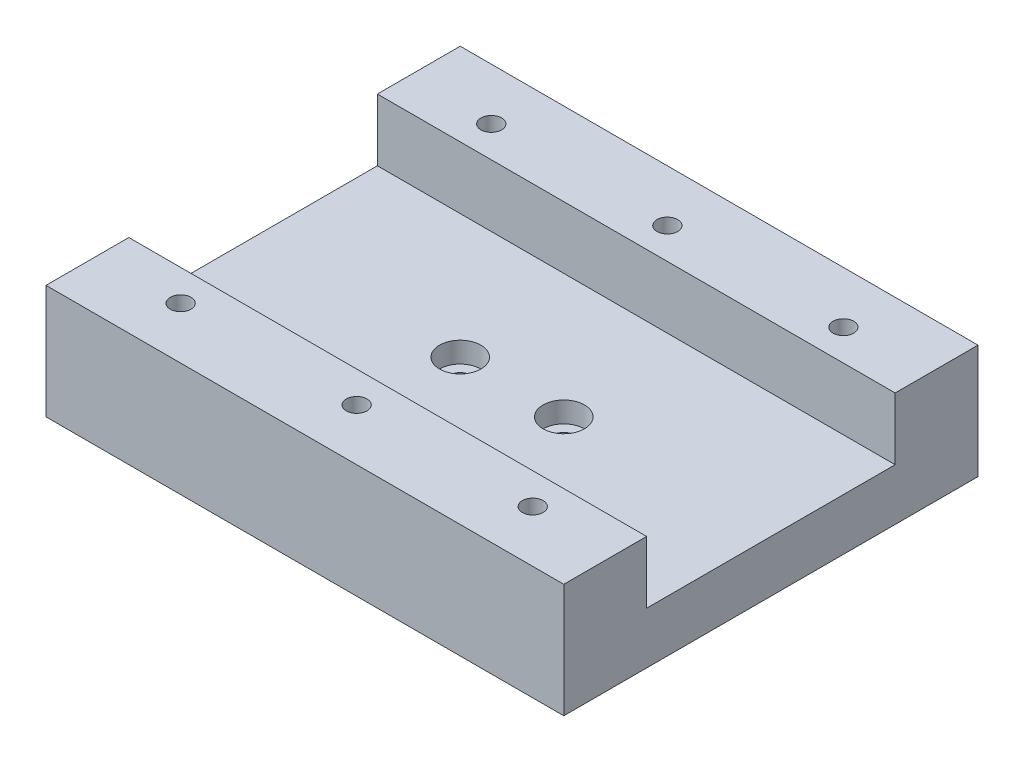
from build123d import *

# Parameters (mm, degrees)
SKETCH1_W               = 50
SKETCH1_H               = 40
BOSS_EXTRUDE1_DEPTH     = 5
SKETCH2_R               = 1
CUT_EXTRUDE1_DEPTH      = 33.403703492
SKETCH3_R               = 2
CUT_EXTRUDE2_DEPTH      = 2
SKETCH5_W               = 50
SKETCH5_H               = 8
BOSS_EXTRUDE2_DEPTH     = 6
CUT_EXTRUDE3_DEPTH      = 33.57299495
CUT_EXTRUDE3_DEPTH_BACK = 33.57299495
SKETCH4_R               = 1


with BuildPart() as part:
    # Sketch1 → Boss-Extrude1 (new body)
    with BuildSketch(Plane(origin=(0, 0, 0), x_dir=(1, 0, 0), z_dir=(0, 1, 0))):
        Rectangle(SKETCH1_W, SKETCH1_H)
    extrude(amount=BOSS_EXTRUDE1_DEPTH)

    # Sketch2 → Cut-Extrude1 (cut, through all)
    with BuildSketch(Plane(origin=(0, 5, 0), x_dir=(1, 0, 0), z_dir=(0, 1, 0))):
        with Locations((-5, 0)):
            Circle(SKETCH2_R)
        with Locations((5, 0)):
            Circle(SKETCH2_R)
    extrude(amount=-CUT_EXTRUDE1_DEPTH, mode=Mode.SUBTRACT)

    # Sketch3 → Cut-Extrude2 (cut)
    with BuildSketch(Plane(origin=(0, 5, 0), x_dir=(1, 0, 0), z_dir=(0, 1, 0))):
        with Locations((-5, 0)):
            Circle(SKETCH3_R)
        with Locations((5, 0)):
            Circle(SKETCH3_R)
    extrude(amount=-CUT_EXTRUDE2_DEPTH, mode=Mode.SUBTRACT)

    # Sketch5 → Boss-Extrude2 (add)
    with BuildSketch(Plane(origin=(0, 5, 0), x_dir=(1, 0, 0), z_dir=(0, 1, 0))):
        with Locations((0, 16)):
            Rectangle(SKETCH5_W, SKETCH5_H)
        with Locations((0, -16)):
            Rectangle(SKETCH5_W, SKETCH5_H)
    extrude(amount=BOSS_EXTRUDE2_DEPTH)

    # Sketch4 → Cut-Extrude3 (cut, two sides: drawn at the far end of the back side and taken through both)
    with BuildSketch(Plane(origin=(0, 5, 0), x_dir=(1, 0, 0), z_dir=(0, 1, 0)).offset(-CUT_EXTRUDE3_DEPTH_BACK)):
        with Locations((-17, 15)):
            Circle(SKETCH4_R)
        with Locations((0, 15)):
            Circle(SKETCH4_R)
        with Locations((17, 15)):
            Circle(SKETCH4_R)
        with Locations((-17, -15)):
            Circle(SKETCH4_R)
        with Locations((0, -15)):
            Circle(SKETCH4_R)
        with Locations((17, -15)):
            Circle(SKETCH4_R)
    extrude(amount=CUT_EXTRUDE3_DEPTH + CUT_EXTRUDE3_DEPTH_BACK, mode=Mode.SUBTRACT)


solid = part.part
